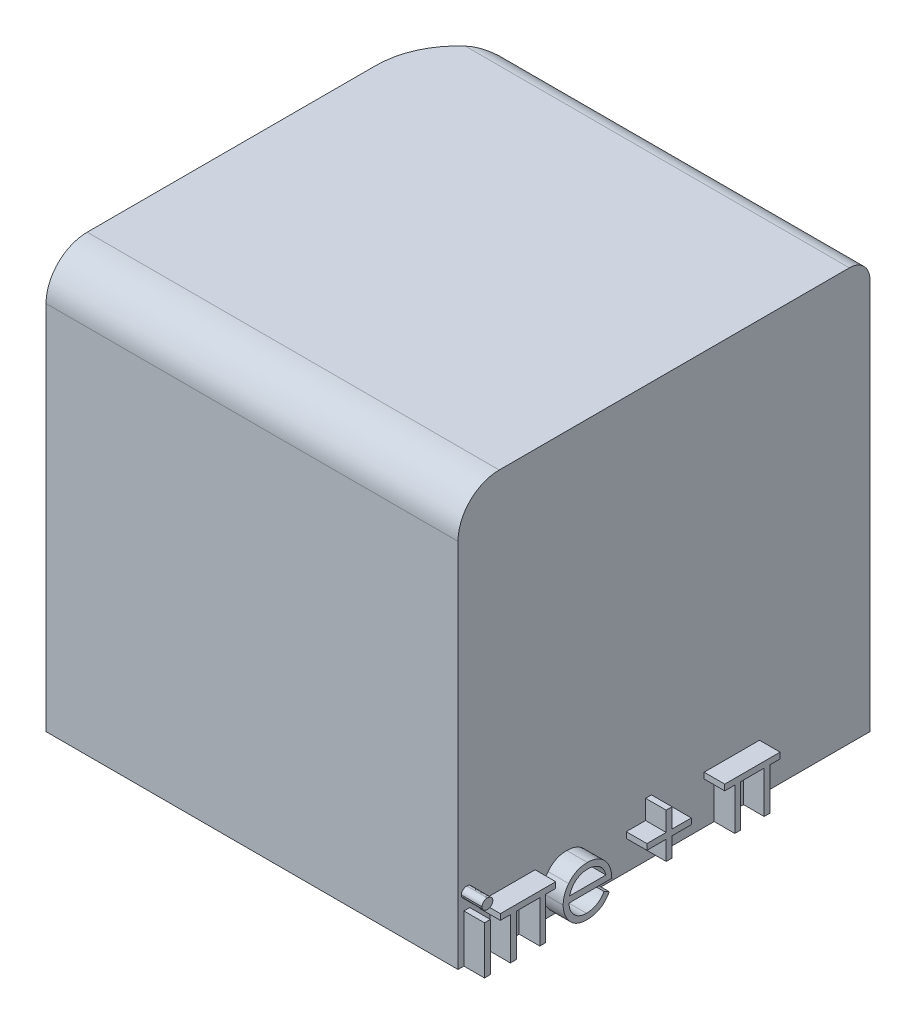
from build123d import *
from OCP.BRepFilletAPI import BRepFilletAPI_MakeFillet

# Parameters (mm, degrees)
SKETCH2_W           = 20
SKETCH2_H           = 20
BOSS_EXTRUDE1_DEPTH = 20
SKETCH3_W           = 0.284935898
SKETCH3_H           = 2.320192308
BOSS_EXTRUDE2_DEPTH = 1
FILLET1_R1          = 2
FILLET1_R2          = 1
FILLET1_R3          = 4


with BuildPart() as part:
    # Sketch2 → Boss-Extrude1 (new body)
    with BuildSketch(Plane(origin=(0, 0, 0), x_dir=(1, 0, 0), z_dir=(0, 1, 0))):
        with Locations((10, -10)):
            Rectangle(SKETCH2_W, SKETCH2_H)
    extrude(amount=BOSS_EXTRUDE1_DEPTH)

    # Sketch3 → Boss-Extrude2 (add)
    # profile 1 of 6: a face of its own
    with BuildSketch(Plane(origin=(20, 0, 0), x_dir=(0, 0, -1), z_dir=(1, 0, 0))):
        with BuildLine():
            add(Edge.make_bspline(
                [(-19.573868189, 3.297115385), (-19.556186781, 3.296295189), (-19.521563189, 3.294689089), (-19.47149501, 3.280935463), (-19.425904721, 3.257622177), (-19.385466349, 3.226344181), (-19.350766423, 3.189560043), (-19.326472493, 3.146687593), (-19.310858391, 3.100370114), (-19.308972844, 3.06806214), (-19.308012821, 3.05161258)],
                knots=[0, 0, 0, 0, 1.055194115, 2.066272739, 3.074728998, 4.095836921, 5.109056067, 6.073838105, 7.019297344, 8, 8, 8, 8], degree=3))
            add(Edge.make_bspline(
                [(-19.308012821, 3.05161258), (-19.308994494, 3.03559003), (-19.310935147, 3.003915346), (-19.326460432, 2.958400839), (-19.350973462, 2.916124096), (-19.385444098, 2.879411381), (-19.425910617, 2.848150675), (-19.471493444, 2.824832805), (-19.521563601, 2.811080395), (-19.55618692, 2.809474127), (-19.573868189, 2.808653846)],
                knots=[0, 0, 0, 0, 0.96129708, 1.900370562, 2.859976407, 3.87933698, 4.906634145, 5.921202961, 6.938410037, 8, 8, 8, 8], degree=3))
            add(Edge.make_bspline(
                [(-19.573868189, 2.808653846), (-19.591347267, 2.809442807), (-19.625368009, 2.810978415), (-19.674686502, 2.825102646), (-19.71988806, 2.848158655), (-19.760405299, 2.879206694), (-19.794178403, 2.916349565), (-19.818760455, 2.958375039), (-19.834249885, 3.003921915), (-19.836195369, 3.035592237), (-19.837179487, 3.05161258)],
                knots=[0, 0, 0, 0, 1.054934014, 2.053291228, 3.073705704, 4.106921865, 5.123545215, 6.088680038, 7.033164197, 8, 8, 8, 8], degree=3))
            add(Edge.make_bspline(
                [(-19.837179487, 3.05161258), (-19.83621693, 3.068059851), (-19.834326407, 3.100363328), (-19.818748845, 3.146713822), (-19.794383162, 3.189332756), (-19.760382936, 3.226548745), (-19.719894012, 3.257614247), (-19.674684964, 3.280665637), (-19.625368416, 3.294791066), (-19.591347405, 3.296326509), (-19.573868189, 3.297115385)],
                knots=[0, 0, 0, 0, 0.98631895, 1.937192651, 2.907499808, 3.917963147, 4.944918757, 5.95915025, 6.951458133, 8, 8, 8, 8], degree=3))
        make_face()
    # profile 2 of 6: a face of its own
    with BuildSketch(Plane(origin=(20, 0, 0), x_dir=(0, 0, -1), z_dir=(1, 0, 0))):
        with Locations((-19.572596154, 1.160096154)):
            Rectangle(SKETCH3_W, SKETCH3_H)
    # profile 3 of 6: a face of its own
    with BuildSketch(Plane(origin=(20, 0, 0), x_dir=(0, 0, -1), z_dir=(1, 0, 0))):
        Polygon((-16.256585145, 2.03525641), (-16.745046683, 2.03525641), (-16.745046683, 0), (-17.029982581, 0), (-17.029982581, 2.03525641), (-18.169726171, 2.03525641), (-18.169726171, 0), (-18.454662068, 0), (-18.454662068, 2.03525641), (-18.943123606, 2.03525641), (-18.943123606, 2.320192308), (-16.256585145, 2.320192308), align=None)
    # profile 4 of 6: a face of its own
    with BuildSketch(Plane(origin=(20, 0, 0), x_dir=(0, 0, -1), z_dir=(1, 0, 0))):
        with BuildLine():
            Line((-13.909152811, 0.732692308), (-13.656017795, 0.599764623))
            add(Edge.make_bspline(
                [(-13.656017795, 0.599764623), (-13.676189563, 0.563983887), (-13.715435837, 0.494368744), (-13.782927944, 0.398726985), (-13.853677895, 0.312686557), (-13.930879352, 0.238546085), (-14.012222561, 0.1739109), (-14.098158612, 0.117361587), (-14.189134897, 0.069175501), (-14.285155718, 0.028578565), (-14.387027454, -0.002635762), (-14.494996972, -0.024683162), (-14.609271115, -0.038311413), (-14.687599435, -0.039894505), (-14.727707498, -0.040705128)],
                knots=[0, 0, 0, 0, 1.120438281, 2.179929193, 3.190490725, 4.156257408, 5.095198341, 6.022838206, 6.959905092, 7.901321166, 8.864066838, 9.862729781, 10.905609505, 12, 12, 12, 12], degree=3))
            add(Edge.make_bspline(
                [(-14.727707498, -0.040705128), (-14.772286292, -0.039664476), (-14.859246605, -0.037634466), (-14.985829089, -0.020133445), (-15.10500899, 0.008416481), (-15.216779607, 0.048299508), (-15.320867222, 0.100394295), (-15.417478712, 0.163857539), (-15.507122139, 0.238363227), (-15.586972671, 0.324556715), (-15.658858193, 0.416796776), (-15.722290902, 0.5129139), (-15.775320143, 0.612666254), (-15.818457153, 0.7154188), (-15.853295852, 0.820523904), (-15.877577076, 0.928937878), (-15.891574062, 1.040367301), (-15.893718952, 1.115748455), (-15.894799846, 1.153735978)],
                knots=[0, 0, 0, 0, 1.145258523, 2.234067595, 3.276747158, 4.290159414, 5.277019952, 6.260822364, 7.254936242, 8.264827045, 9.274100331, 10.257902744, 11.220704747, 12.172965371, 13.118907548, 14.062713208, 15.023725156, 16, 16, 16, 16], degree=3))
            add(Edge.make_bspline(
                [(-15.894799846, 1.153735978), (-15.893839054, 1.189382002), (-15.89193489, 1.260027716), (-15.879932675, 1.364590031), (-15.858661724, 1.466215842), (-15.829473201, 1.564989591), (-15.791780285, 1.660745898), (-15.745668201, 1.753543042), (-15.691065115, 1.843282276), (-15.648907761, 1.899890833), (-15.627672442, 1.928405449)],
                knots=[0, 0, 0, 0, 1.024358464, 2.0301432, 3.019427413, 4.004406732, 4.986367066, 5.972626655, 6.978780325, 8, 8, 8, 8], degree=3))
            add(Edge.make_bspline(
                [(-15.627672442, 1.928405449), (-15.598909044, 1.962757924), (-15.5422934, 2.030374674), (-15.446538706, 2.119218727), (-15.342852099, 2.193644152), (-15.232532981, 2.25533634), (-15.11429918, 2.302211719), (-14.989740037, 2.337143598), (-14.857437256, 2.356717936), (-14.766990377, 2.359482757), (-14.720711304, 2.360897436)],
                knots=[0, 0, 0, 0, 1.030682036, 2.02871468, 2.997146059, 3.962720338, 4.930598197, 5.918074684, 6.934738563, 8, 8, 8, 8], degree=3))
            add(Edge.make_bspline(
                [(-14.720711304, 2.360897436), (-14.673133834, 2.35966912), (-14.579797682, 2.357259445), (-14.443697115, 2.334919842), (-14.314918465, 2.299493596), (-14.193513265, 2.249461229), (-14.079469206, 2.18490935), (-13.973527575, 2.104952108), (-13.87387656, 2.012044272), (-13.815902349, 1.940594789), (-13.786401409, 1.904236779)],
                knots=[0, 0, 0, 0, 1.056321875, 2.072262726, 3.055038591, 4.01806755, 4.982017516, 5.957941055, 6.960871419, 8, 8, 8, 8], degree=3))
            add(Edge.make_bspline(
                [(-13.786401409, 1.904236779), (-13.766329115, 1.876837816), (-13.726318134, 1.822222265), (-13.676201121, 1.733167001), (-13.632696913, 1.639993819), (-13.597923441, 1.541196621), (-13.56976618, 1.437946002), (-13.549394637, 1.329503836), (-13.537447911, 1.215902417), (-13.535099593, 1.138499042), (-13.53390241, 1.099038462)],
                knots=[0, 0, 0, 0, 0.94817472, 1.890038105, 2.849395472, 3.817997239, 4.812318967, 5.836947057, 6.897266129, 8, 8, 8, 8], degree=3))
            Line((-13.53390241, 1.099038462), (-15.609863949, 1.099038462))
            add(Edge.make_bspline(
                [(-15.609863949, 1.099038462), (-15.608467306, 1.068467326), (-15.605720864, 1.008350421), (-15.592916412, 0.920384068), (-15.572733596, 0.836588251), (-15.544368089, 0.757591491), (-15.510017451, 0.682362018), (-15.467938979, 0.611457885), (-15.417738098, 0.545202048), (-15.361744071, 0.483001859), (-15.29941692, 0.427611026), (-15.233846142, 0.378034057), (-15.164092694, 0.336481837), (-15.090706576, 0.302754366), (-15.013806456, 0.276350779), (-14.933368108, 0.258327828), (-14.849549816, 0.246256381), (-14.792412758, 0.244914113), (-14.763324485, 0.244230769)],
                knots=[0, 0, 0, 0, 1.094153842, 2.151609401, 3.174256925, 4.172055639, 5.149267565, 6.128595816, 7.11444997, 8.118368179, 9.117203808, 10.09244225, 11.054858984, 12.015122123, 12.976791628, 13.957293641, 14.960065497, 16, 16, 16, 16], degree=3))
            add(Edge.make_bspline(
                [(-14.763324485, 0.244230769), (-14.734884516, 0.244782363), (-14.678454161, 0.245876832), (-14.594415669, 0.256519351), (-14.511739097, 0.273728102), (-14.430766634, 0.297214021), (-14.353141652, 0.325858737), (-14.281254617, 0.360423472), (-14.21514185, 0.398659314), (-14.153350031, 0.442392376), (-14.093414201, 0.495921231), (-14.033957803, 0.56271935), (-13.970206839, 0.641720179), (-13.930301994, 0.701179461), (-13.909152811, 0.732692308)],
                knots=[0, 0, 0, 0, 0.99110716, 1.966546729, 2.947904876, 3.932708344, 4.903319531, 5.828989031, 6.710028674, 7.56322171, 8.463672341, 9.504779593, 10.677557249, 12, 12, 12, 12], degree=3))
        make_face()
        with BuildLine():
            add(Edge.make_bspline(
                [(-13.818838308, 1.383974359), (-13.829267388, 1.421768537), (-13.849340012, 1.494510165), (-13.891283, 1.595240115), (-13.938519326, 1.68476414), (-13.994419039, 1.762397092), (-14.057754598, 1.831343136), (-14.130911299, 1.891594282), (-14.212949574, 1.945494398), (-14.303445366, 1.990989879), (-14.399277556, 2.02971568), (-14.499613173, 2.055682749), (-14.60199131, 2.073471405), (-14.671237412, 2.075127947), (-14.706082899, 2.075961538)],
                knots=[0, 0, 0, 0, 1.154881502, 2.222775134, 3.210006277, 4.132804581, 5.035138423, 5.962687519, 6.919655026, 7.923214229, 8.944639381, 9.960483929, 10.97369054, 12, 12, 12, 12], degree=3))
            add(Edge.make_bspline(
                [(-14.706082899, 2.075961538), (-14.734521318, 2.075406665), (-14.790738094, 2.074309797), (-14.873561206, 2.063904751), (-14.953099219, 2.046705463), (-15.029939015, 2.023151538), (-15.10307366, 1.991756592), (-15.174007485, 1.954941807), (-15.240936845, 1.910000514), (-15.282793592, 1.875747838), (-15.303939469, 1.85844351)],
                knots=[0, 0, 0, 0, 1.04873581, 2.073130211, 3.073294108, 4.04793562, 5.032784715, 6.005352987, 6.992311501, 8, 8, 8, 8], degree=3))
            add(Edge.make_bspline(
                [(-15.303939469, 1.85844351), (-15.319082661, 1.844750809), (-15.34972879, 1.81704012), (-15.390677691, 1.769297911), (-15.429884835, 1.717816137), (-15.465566077, 1.660625203), (-15.498293602, 1.598376353), (-15.528918724, 1.531594641), (-15.55648354, 1.459773302), (-15.571992154, 1.409724017), (-15.57997112, 1.383974359)],
                knots=[0, 0, 0, 0, 0.879870761, 1.780643979, 2.707998968, 3.669668524, 4.684282772, 5.740141944, 6.837334558, 8, 8, 8, 8], degree=3))
            Line((-15.57997112, 1.383974359), (-13.818838308, 1.383974359))
        make_face(mode=Mode.SUBTRACT)
    # profile 5 of 6: a face of its own
    with BuildSketch(Plane(origin=(20, 0, 0), x_dir=(0, 0, -1), z_dir=(1, 0, 0))):
        Polygon((-10.894403598, 1.709615385), (-10.894403598, 2.645833333), (-10.6094677, 2.645833333), (-10.6094677, 1.709615385), (-9.673249751, 1.709615385), (-9.673249751, 1.424679487), (-10.6094677, 1.424679487), (-10.6094677, 0.488461538), (-10.894403598, 0.488461538), (-10.894403598, 1.424679487), (-11.830621546, 1.424679487), (-11.830621546, 1.709615385), align=None)
    # profile 6 of 6: a face of its own
    with BuildSketch(Plane(origin=(20, 0, 0), x_dir=(0, 0, -1), z_dir=(1, 0, 0))):
        Polygon((-5.364587302, 2.03525641), (-5.85304884, 2.03525641), (-5.85304884, 0), (-6.137984738, 0), (-6.137984738, 2.03525641), (-7.277728327, 2.03525641), (-7.277728327, 0), (-7.562664225, 0), (-7.562664225, 2.03525641), (-8.051125763, 2.03525641), (-8.051125763, 2.320192308), (-5.364587302, 2.320192308), align=None)
    extrude(amount=BOSS_EXTRUDE2_DEPTH)

    # Fillet1: one fillet with a radius per group of edges: ONE call of the kernel's fillet builder (fillet() takes one radius for all edges)
    fillet1_edges_1 = [part.edges().sort_by_distance(p)[0] for p in [
        (10, 20, 20),
    ]]
    fillet1_edges_2 = [part.edges().sort_by_distance(p)[0] for p in [
        (10, 20, 0),
    ]]
    fillet1_edges_3 = [part.edges().sort_by_distance(p)[0] for p in [
        (0, 10, 0),
    ]]
    fillet1 = BRepFilletAPI_MakeFillet(part.part.solid().wrapped)
    for e in fillet1_edges_1:
        fillet1.Add(FILLET1_R1, e.wrapped)
    for e in fillet1_edges_2:
        fillet1.Add(FILLET1_R2, e.wrapped)
    for e in fillet1_edges_3:
        fillet1.Add(FILLET1_R3, e.wrapped)
    add(Compound.cast(fillet1.Shape()), mode=Mode.REPLACE)


solid = part.part
